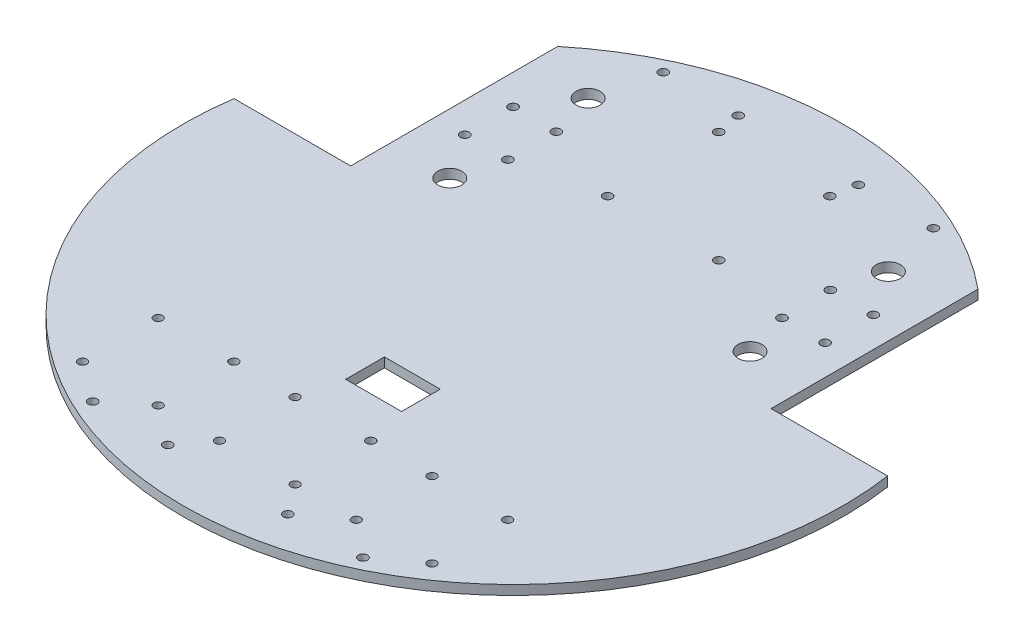
from build123d import *

# Parameters (mm, degrees)
SKETCH_1_R   = 1.5
SKETCH_1_R_2 = 4
SKETCH_1_R_3 = 1.45
SKETCH_1_W   = 18.6
SKETCH_1_H   = 12.9
BASE_DEPTH   = 3.175


with BuildPart() as part:
    # 草图1 → Base (new body)
    with BuildSketch(Plane(origin=(0, 0, 0), x_dir=(1, 0, 0), z_dir=(0, 1, 0))):
        with BuildLine():
            Line((-108.841874295, 15.92), (-70, 15.92))
            Line((-70, 15.92), (-70, 84.852813742))
            ThreePointArc((-70, 84.852813742), (0, 110), (70, 84.852813742))
            Line((70, 84.852813742), (70, 15.92))
            Line((70, 15.92), (108.841874295, 15.92))
            ThreePointArc((108.841874295, 15.92), (0, -110), (-108.841874295, 15.92))
        make_face()
        with Locations((-60, 43.92)):
            Circle(SKETCH_1_R, mode=Mode.SUBTRACT)
        with Locations((-60, 60)):
            Circle(SKETCH_1_R, mode=Mode.SUBTRACT)
        with Locations((-45.65, 60)):
            Circle(SKETCH_1_R, mode=Mode.SUBTRACT)
        with Locations((-45.65, 43.92)):
            Circle(SKETCH_1_R, mode=Mode.SUBTRACT)
        with Locations((60, 60)):
            Circle(SKETCH_1_R, mode=Mode.SUBTRACT)
        with Locations((45.65, 60)):
            Circle(SKETCH_1_R, mode=Mode.SUBTRACT)
        with Locations((45.65, 43.92)):
            Circle(SKETCH_1_R, mode=Mode.SUBTRACT)
        with Locations((60, 43.92)):
            Circle(SKETCH_1_R, mode=Mode.SUBTRACT)
        with Locations((-20, -95)):
            Circle(SKETCH_1_R, mode=Mode.SUBTRACT)
        with Locations((20, -95)):
            Circle(SKETCH_1_R, mode=Mode.SUBTRACT)
        with Locations((20, 95)):
            Circle(SKETCH_1_R, mode=Mode.SUBTRACT)
        with Locations((-20, 95)):
            Circle(SKETCH_1_R, mode=Mode.SUBTRACT)
        with Locations((-50, 75)):
            Circle(SKETCH_1_R_2, mode=Mode.SUBTRACT)
        with Locations((50, 75)):
            Circle(SKETCH_1_R_2, mode=Mode.SUBTRACT)
        with Locations((-18.5, 87)):
            Circle(SKETCH_1_R, mode=Mode.SUBTRACT)
        with Locations((-18.5, 50)):
            Circle(SKETCH_1_R, mode=Mode.SUBTRACT)
        with Locations((18.5, 50)):
            Circle(SKETCH_1_R, mode=Mode.SUBTRACT)
        with Locations((18.5, 87)):
            Circle(SKETCH_1_R, mode=Mode.SUBTRACT)
        with Locations((-12.6, -60)):
            Circle(SKETCH_1_R_3, mode=Mode.SUBTRACT)
        with Locations((-12.6, -85.2)):
            Circle(SKETCH_1_R_3, mode=Mode.SUBTRACT)
        with Locations((12.6, -85.2)):
            Circle(SKETCH_1_R_3, mode=Mode.SUBTRACT)
        with Locations((12.6, -60)):
            Circle(SKETCH_1_R_3, mode=Mode.SUBTRACT)
        with Locations((-45, 95)):
            Circle(SKETCH_1_R, mode=Mode.SUBTRACT)
        with Locations((45, 95)):
            Circle(SKETCH_1_R, mode=Mode.SUBTRACT)
        with Locations((45, -95)):
            Circle(SKETCH_1_R, mode=Mode.SUBTRACT)
        with Locations((-45, -95)):
            Circle(SKETCH_1_R, mode=Mode.SUBTRACT)
        with Locations((-58.2, -60)):
            Circle(SKETCH_1_R_3, mode=Mode.SUBTRACT)
        with Locations((-58.2, -85.2)):
            Circle(SKETCH_1_R_3, mode=Mode.SUBTRACT)
        with Locations((-33, -60)):
            Circle(SKETCH_1_R_3, mode=Mode.SUBTRACT)
        with Locations((-33, -85.2)):
            Circle(SKETCH_1_R_3, mode=Mode.SUBTRACT)
        with Locations((58.2, -85.2)):
            Circle(SKETCH_1_R_3, mode=Mode.SUBTRACT)
        with Locations((33, -85.2)):
            Circle(SKETCH_1_R_3, mode=Mode.SUBTRACT)
        with Locations((33, -60)):
            Circle(SKETCH_1_R_3, mode=Mode.SUBTRACT)
        with Locations((58.2, -60)):
            Circle(SKETCH_1_R_3, mode=Mode.SUBTRACT)
        with Locations((-50, 28.92)):
            Circle(SKETCH_1_R_2, mode=Mode.SUBTRACT)
        with Locations((50, 28.92)):
            Circle(SKETCH_1_R_2, mode=Mode.SUBTRACT)
        with Locations((0, -40)):
            Rectangle(SKETCH_1_W, SKETCH_1_H, mode=Mode.SUBTRACT)
    extrude(amount=BASE_DEPTH)


solid = part.part
